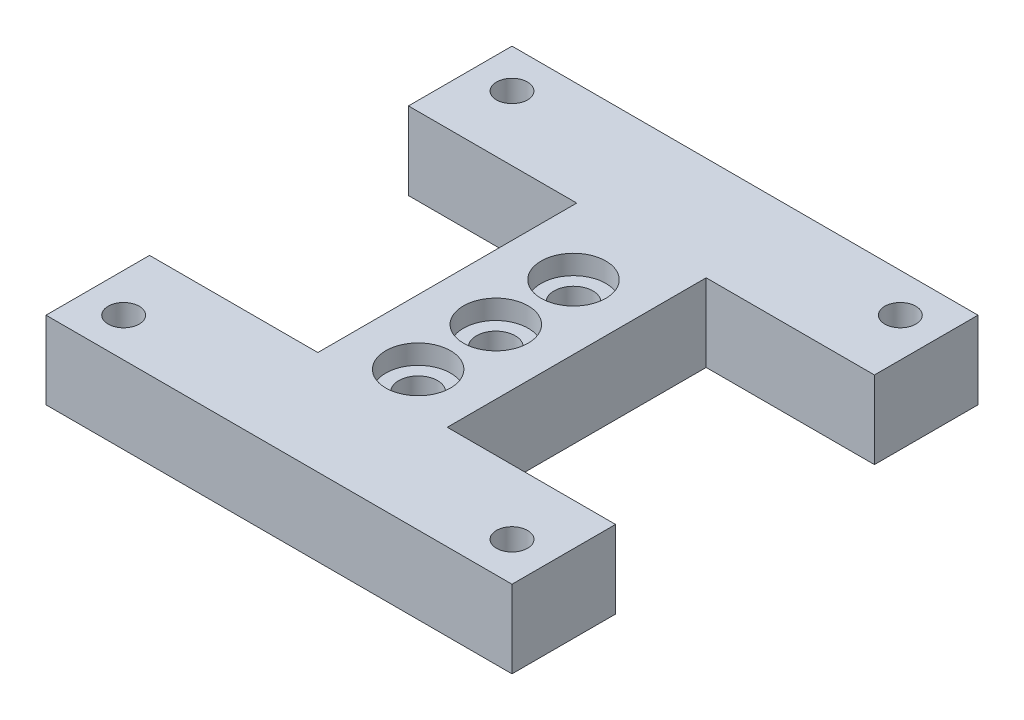
from build123d import *

# Parameters (mm, degrees)
BOSS_EXTRUDE1_DEPTH = 6
SKETCH2_R           = 1.2
SKETCH2_R_2         = 1.5
CUT_EXTRUDE1_DEPTH  = 6
SKETCH3_2_R         = 2.5
CUT_EXTRUDE5_DEPTH  = 1.5
SKETCH5_R           = 2.2
CUT_EXTRUDE6_DEPTH  = 2


with BuildPart() as part:
    # Sketch1 → Boss-Extrude1 (new body)
    with BuildSketch(Plane(origin=(0, 0, 0), x_dir=(1, 0, 0), z_dir=(0, 1, 0))):
        Polygon((-5, 10), (-5, -10), (-18, -10), (-18, -18), (18, -18), (18, -10), (5, -10), (5, 10), (18, 10), (18, 18), (-18, 18), (-18, 10), align=None)
    extrude(amount=BOSS_EXTRUDE1_DEPTH)

    # Sketch2 → Cut-Extrude1 (cut)
    with BuildSketch(Plane(origin=(0, 6, 0), x_dir=(1, 0, 0), z_dir=(0, 1, 0))):
        with Locations((-15, 15)):
            Circle(SKETCH2_R)
        with Locations((-15, -15)):
            Circle(SKETCH2_R)
        with Locations((15, -15)):
            Circle(SKETCH2_R)
        with Locations((15, 15)):
            Circle(SKETCH2_R)
        with Locations((0, -1.25)):
            Circle(SKETCH2_R_2)
        with Locations((0, 4.75)):
            Circle(SKETCH2_R_2)
        with Locations((0, -7.25)):
            Circle(SKETCH2_R_2)
    extrude(amount=-CUT_EXTRUDE1_DEPTH, mode=Mode.SUBTRACT)

    # Sketch3<2> → Cut-Extrude5 (cut)
    with BuildSketch(Plane(origin=(0, 6, 0), x_dir=(1, 0, 0), z_dir=(0, 1, 0))):
        with Locations((0, 4.75)):
            Circle(SKETCH3_2_R)
        with Locations((0, -1.25)):
            Circle(SKETCH3_2_R)
        with Locations((0, -7.25)):
            Circle(SKETCH3_2_R)
    extrude(amount=-CUT_EXTRUDE5_DEPTH, mode=Mode.SUBTRACT)

    # Sketch5 → Cut-Extrude6 (cut)
    with BuildSketch(Plane.XZ):
        with Locations((-15, 15)):
            Circle(SKETCH5_R)
        with Locations((15, 15)):
            Circle(SKETCH5_R)
        with Locations((15, -15)):
            Circle(SKETCH5_R)
        with Locations((-15, -15)):
            Circle(SKETCH5_R)
    extrude(amount=-CUT_EXTRUDE6_DEPTH, mode=Mode.SUBTRACT)


solid = part.part
